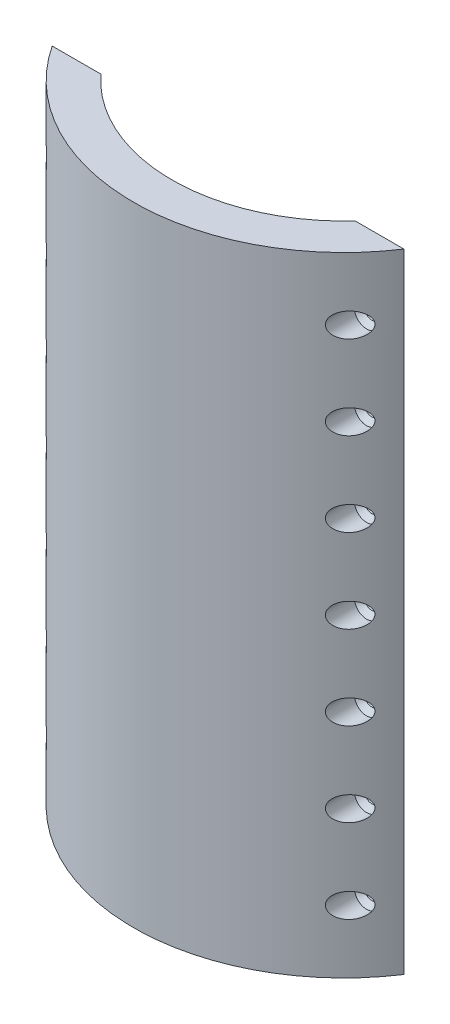
from build123d import *

# Parameters (mm, degrees)
BOSS_EXTRUDE1_DEPTH = 150
LPATTERN1_COUNT     = 7
LPATTERN1_PITCH     = 20


with BuildPart() as part:
    # Sketch1 → Boss-Extrude1 (new body)
    with BuildSketch(Plane(origin=(60.535204745, 0, -85.948449604), x_dir=(1, 0, 0), z_dir=(0, 1, 0))):
        with BuildLine():
            ThreePointArc((-30.186446753, -113.644462538), (-60.535204745, -127.035141416), (-90.883962736, -113.644462538))
            Line((-90.883962736, -113.644462538), (-102.513962844, -113.644462538))
            ThreePointArc((-102.513962844, -113.644462538), (-60.535204745, -136.240449604), (-18.556446645, -113.644462538))
            Line((-18.556446645, -113.644462538), (-30.186446753, -113.644462538))
        make_face()
    extrude(amount=BOSS_EXTRUDE1_DEPTH)

    # Sketch6 → Cut-Revolve4 (revolve, cut)
    with BuildSketch(Plane(origin=(36.163758045, 15, 27.696012934), x_dir=(-1, 0, 0), z_dir=(0, -1, 0))):
        Polygon((0, 1.685394277), (0, -4.78184701), (0, -15.185924704), (-2.9, -15.185924704), (-2.9, -3.079025683), (-1.65, -1.881964943), (-1.65, 1.685394277), align=None)
    cut_revolve4 = revolve(axis=Axis((36.163758045, 15, 26.010618657), (0, 0, 1)), mode=Mode.SUBTRACT)

    # LPattern1: Cut-Revolve4 ×7
    with Locations(*[(0, i * LPATTERN1_PITCH, 0) for i in range(1, LPATTERN1_COUNT)]):
        add(cut_revolve4, mode=Mode.SUBTRACT)

    # Mirror1: Cut-Revolve4 across plane
    add(cut_revolve4.mirror(Plane(origin=(0, 0, 0), x_dir=(0, 0, 1), z_dir=(1, 0, 0))), mode=Mode.SUBTRACT)

    # Mirror1 copy 1 sketch → Mirror1 copy 1 (revolve, cut)
    with BuildSketch(Plane(origin=(-36.163758045, 35, 27.696012934), x_dir=(1, 0, 0), z_dir=(0, -1, 0))):
        Polygon((0, -1.685394277), (0, 4.78184701), (0, 15.185924704), (-2.9, 15.185924704), (-2.9, 3.079025683), (-1.65, 1.881964943), (-1.65, -1.685394277), align=None)
    revolve(axis=Axis((-36.163758045, 35, 26.010618657), (0, 0, -1)), mode=Mode.SUBTRACT)

    # Mirror1 copy 2 sketch → Mirror1 copy 2 (revolve, cut)
    with BuildSketch(Plane(origin=(-36.163758045, 55, 27.696012934), x_dir=(1, 0, 0), z_dir=(0, -1, 0))):
        Polygon((0, -1.685394277), (0, 4.78184701), (0, 15.185924704), (-2.9, 15.185924704), (-2.9, 3.079025683), (-1.65, 1.881964943), (-1.65, -1.685394277), align=None)
    revolve(axis=Axis((-36.163758045, 55, 26.010618657), (0, 0, -1)), mode=Mode.SUBTRACT)

    # Mirror1 copy 3 sketch → Mirror1 copy 3 (revolve, cut)
    with BuildSketch(Plane(origin=(-36.163758045, 75, 27.696012934), x_dir=(1, 0, 0), z_dir=(0, -1, 0))):
        Polygon((0, -1.685394277), (0, 4.78184701), (0, 15.185924704), (-2.9, 15.185924704), (-2.9, 3.079025683), (-1.65, 1.881964943), (-1.65, -1.685394277), align=None)
    revolve(axis=Axis((-36.163758045, 75, 26.010618657), (0, 0, -1)), mode=Mode.SUBTRACT)

    # Mirror1 copy 4 sketch → Mirror1 copy 4 (revolve, cut)
    with BuildSketch(Plane(origin=(-36.163758045, 95, 27.696012934), x_dir=(1, 0, 0), z_dir=(0, -1, 0))):
        Polygon((0, -1.685394277), (0, 4.78184701), (0, 15.185924704), (-2.9, 15.185924704), (-2.9, 3.079025683), (-1.65, 1.881964943), (-1.65, -1.685394277), align=None)
    revolve(axis=Axis((-36.163758045, 95, 26.010618657), (0, 0, -1)), mode=Mode.SUBTRACT)

    # Mirror1 copy 5 sketch → Mirror1 copy 5 (revolve, cut)
    with BuildSketch(Plane(origin=(-36.163758045, 115, 27.696012934), x_dir=(1, 0, 0), z_dir=(0, -1, 0))):
        Polygon((0, -1.685394277), (0, 4.78184701), (0, 15.185924704), (-2.9, 15.185924704), (-2.9, 3.079025683), (-1.65, 1.881964943), (-1.65, -1.685394277), align=None)
    revolve(axis=Axis((-36.163758045, 115, 26.010618657), (0, 0, -1)), mode=Mode.SUBTRACT)

    # Mirror1 copy 6 sketch → Mirror1 copy 6 (revolve, cut)
    with BuildSketch(Plane(origin=(-36.163758045, 135, 27.696012934), x_dir=(1, 0, 0), z_dir=(0, -1, 0))):
        Polygon((0, -1.685394277), (0, 4.78184701), (0, 15.185924704), (-2.9, 15.185924704), (-2.9, 3.079025683), (-1.65, 1.881964943), (-1.65, -1.685394277), align=None)
    revolve(axis=Axis((-36.163758045, 135, 26.010618657), (0, 0, -1)), mode=Mode.SUBTRACT)


solid = part.part
